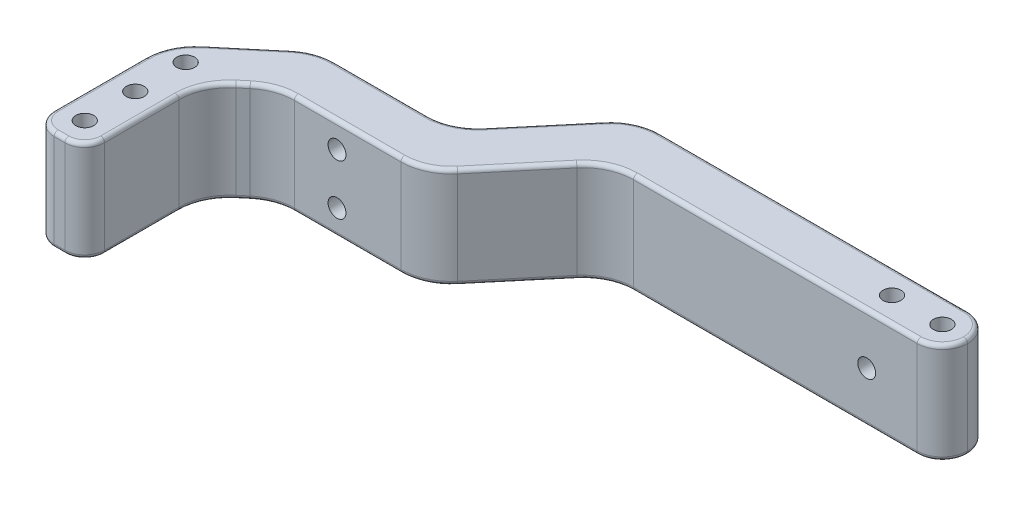
from build123d import *

# Parameters (mm, degrees)
SKETCH1_R           = 2.25
BOSS_EXTRUDE1_DEPTH = 25.4
FILLET2_R           = 5
SKETCH3_R           = 2.25
CUT_EXTRUDE2_DEPTH  = 178.913356722
FILLET4_R           = 12.7
FILLET6_R           = 6.35
FILLET5_R           = 1


with BuildPart() as part:
    # Sketch1 → Boss-Extrude1 (new body)
    with BuildSketch(Plane(origin=(0, 0, 0), x_dir=(1, 0, 0), z_dir=(0, 1, 0))):
        Polygon((53.761053629, 31.75), (75.074184261, 57.15), (158.75, 57.15), (158.75, 69.85), (69.152077003, 69.85), (47.838946371, 44.45), (13.874173221, 44.45), (-6.35, 27.479903709), (-6.35, -6.35), (6.35, -6.35), (6.35, 23.320096291), (16.39636803, 31.75), align=None)
        with Locations(Location((0, 0, 0), (0, 0, 270))):
            Circle(SKETCH1_R, mode=Mode.SUBTRACT)
        with Locations(Location((0, 12.7, 0), (0, 0, 270))):
            Circle(SKETCH1_R, mode=Mode.SUBTRACT)
        with Locations(Location((0, 25.4, 0), (0, 0, 270))):
            Circle(SKETCH1_R, mode=Mode.SUBTRACT)
        with Locations(Location((152.4, 63.5, 0), (0, 0, 270))):
            Circle(SKETCH1_R, mode=Mode.SUBTRACT)
        with Locations(Location((139.7, 63.5, 0), (0, 0, 270))):
            Circle(SKETCH1_R, mode=Mode.SUBTRACT)
    extrude(amount=BOSS_EXTRUDE1_DEPTH)

    # Fillet2
    fillet2_edges = [part.edges().sort_by_distance(p)[0] for p in [
        (6.35, 12.7, 6.35),
        (-6.35, 12.7, 6.35),
    ]]
    fillet(fillet2_edges, radius=FILLET2_R)

    # Sketch3 → Cut-Extrude2 (cut, through all)
    with BuildSketch(Plane(origin=(0, 0, -69.85), x_dir=(-1, 0, 0), z_dir=(0, 0, -1))):
        with Locations((-31.75, 6.35)):
            Circle(SKETCH3_R)
        with Locations((-31.75, 19.05)):
            Circle(SKETCH3_R)
        with Locations(Location((-139.7, 12.7, 0), (0, 0, 180))):
            Circle(SKETCH3_R)
    extrude(amount=-CUT_EXTRUDE2_DEPTH, mode=Mode.SUBTRACT)

    # Fillet4
    fillet4_edges = [part.edges().sort_by_distance(p)[0] for p in [
        (-6.35, 12.7, -27.479903709),
        (13.874173221, 12.7, -44.45),
        (47.838946371, 12.7, -44.45),
        (69.152077003, 12.7, -69.85),
        (75.074184261, 12.7, -57.15),
        (53.761053629, 12.7, -31.75),
        (16.39636803, 12.7, -31.75),
        (6.35, 12.7, -23.320096291),
    ]]
    fillet(fillet4_edges, radius=FILLET4_R)

    # Fillet6
    fillet6_edges = [part.edges().sort_by_distance(p)[0] for p in [
        (158.75, 12.7, -69.85),
        (158.75, 12.7, -57.15),
    ]]
    fillet(fillet6_edges, radius=FILLET6_R - 0.0001)  # a hair under: the kernel refuses the full size

    # Fillet5
    fillet5_edges = [part.edges().sort_by_distance(p)[0] for p in [
        (113.737142131, 25.4, -69.85),
        (6.35, 25.4, -8.023994516),
        (11.87099236, 25.4, -27.952758944),
        (34.428868188, 25.4, -31.75),
        (64.417618945, 25.4, -44.45),
        (30.206717154, 25.4, -44.45),
        (4.259894955, 25.4, -36.382662653),
        (-5.160108895, 25.4, -26.925048375),
        (14.152939376, 25.4, -43.684096284),
        (53.206198295, 25.4, -32.939891105),
        (69.706932337, 25.4, -68.660108895),
        (47.284091036, 0, -45.639891105),
        (47.284091036, 25.4, -45.639891105),
        (75.629039596, 0, -55.960108895),
        (75.629039596, 25.4, -55.960108895),
        (16.675134185, 0, -30.984096284),
        (16.675134185, 25.4, -30.984096284),
        (7.539891105, 0, -22.765240957),
        (7.539891105, 25.4, -22.765240957),
        (116.69819576, 0, -57.15),
        (156.89015735, 0, -59.00984265),
        (156.89015735, 0, -67.99015735),
        (116.69819576, 25.4, -57.15),
        (156.89015735, 25.4, -59.00984265),
        (156.89015735, 25.4, -67.99015735),
        (0, 0, 6.35),
        (0, 25.4, 6.35),
        (-6.35, 0, -10.103898225),
        (4.885533906, 0, 4.885533906),
        (-4.885533906, 0, 4.885533906),
        (-6.35, 25.4, -10.103898225),
        (4.885533906, 25.4, 4.885533906),
        (-4.885533906, 25.4, 4.885533906),
        (58.495511687, 0, -57.15),
        (58.495511687, 25.4, -57.15),
        (4.259894955, 0, -36.382662653),
        (30.206717154, 0, -44.45),
        (113.737142131, 0, -69.85),
        (64.417618945, 0, -44.45),
        (34.428868188, 0, -31.75),
        (11.87099236, 0, -27.952758944),
        (6.35, 0, -8.023994516),
        (-5.160108895, 0, -26.925048375),
        (14.152939376, 0, -43.684096284),
        (53.206198295, 0, -32.939891105),
        (69.706932337, 0, -68.660108895),
    ]]
    fillet(fillet5_edges, radius=FILLET5_R)


solid = part.part
